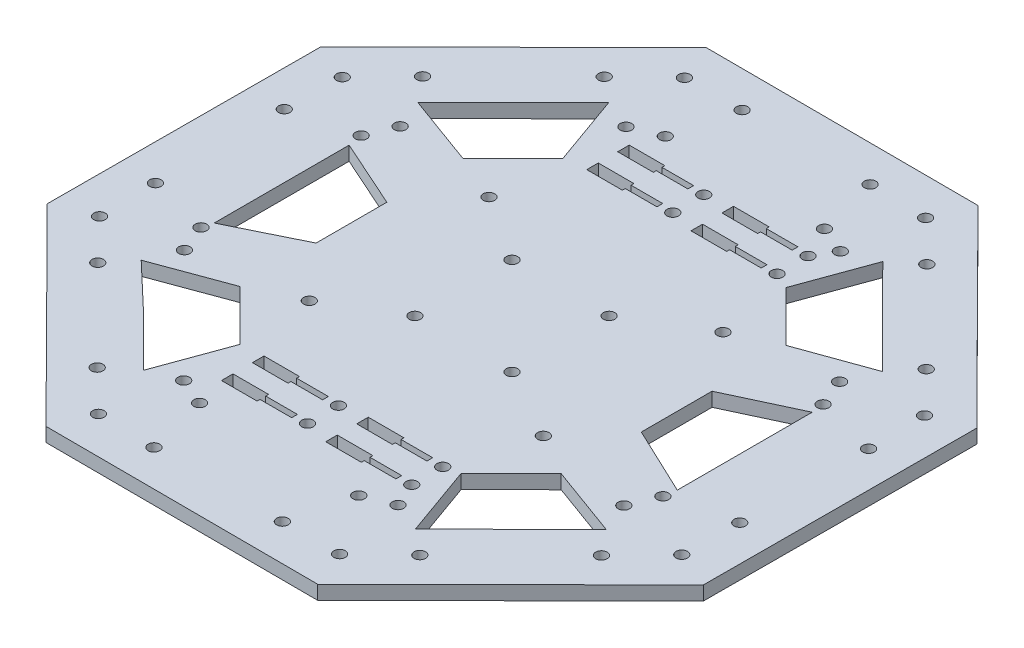
from build123d import *

# Parameters (mm, degrees)
BOSS_EXTRUDE1_DEPTH              = 4.318
CUT_EXTRUDE1_DEPTH               = 12.7
F_15_0_14_DIAMETER_HOLE1_D       = 3.556
F_15_0_14_DIAMETER_HOLE3_D       = 3.556
F_15_0_14_DIAMETER_HOLE4_D       = 3.556
F_15_0_14_DIAMETER_HOLE5_D       = 3.556
SKETCH27_R                       = 1.78
CUT_EXTRUDE2_DEPTH               = 10
F_37_0_14015748_DIAMETER_HOLE1_D = 3.559999992


with BuildPart() as part:
    # Sketch1 → Boss-Extrude1 (new body)
    with BuildSketch(Plane(origin=(0, 0, 0), x_dir=(1, 0, 0), z_dir=(0, 1, 0))):
        Polygon((-101.734861683, -41.757025965), (-42.410734357, -101.464086802), (41.757025965, -101.734861683), (101.464086802, -42.410734357), (101.734861683, 41.757025965), (42.410734357, 101.464086802), (-41.757025965, 101.734861683), (-101.464086802, 42.410734357), align=None)
    extrude(amount=BOSS_EXTRUDE1_DEPTH)

    # Sketch6 → Cut-Extrude1 (cut)
    with BuildSketch(Plane(origin=(0, 4.318, 0), x_dir=(1, 0, 0), z_dir=(0, 1, 0))):
        Polygon((-71.63902199, 42.550988515), (-56.864098396, 57.231152574), (-42.089174802, 71.911316632), (-34.257082159, 49.974181796), (-42.004907946, 42.276046985), (-49.72792821, 34.553026721), align=None)
        Polygon((71.63902199, -42.550988515), (56.864098396, -57.231152574), (42.089174802, -71.911316632), (34.257082159, -49.974181796), (42.004907946, -42.276046985), (49.752733734, -34.577912173), align=None)
        Polygon((42.697293757, 71.784388897), (57.377457815, 57.009465303), (72.088409596, 42.33049548), (50.120487037, 34.402449066), (42.422352226, 42.150274854), (34.724217415, 49.898100641), align=None)
        Polygon((-42.368336547, -71.457541467), (-57.048500606, -56.682617873), (-72.149390573, -42.337977544), (-49.816415281, -34.100407159), (-42.093395016, -41.823427424), (-34.370374752, -49.546447688), align=None)
        Polygon((72.088409596, -0.231914577), (72.088409596, 20.595875803), (51.006409596, 10.757908019), (51.006409596, -0.164091981), (51.006409596, -11.086091981), (72.088409596, -21.060124197), align=None)
        Polygon((-70.80992821, 20.525505482), (-70.80992821, -21.130494518), (-49.72792821, -10.762021003), (-49.72792821, 0.159978997), (-49.72792821, 11.081978997), align=None)
    extrude(amount=-CUT_EXTRUDE1_DEPTH, mode=Mode.SUBTRACT)

    # #15 (0.14) Diameter Hole1 (through all)
    with Locations(Plane(origin=(-37.639526742, 4.318, 90.049377036), x_dir=(0, 0, 1), z_dir=(0, 1, 0))):
        with Locations((0, 0), (0.240312708, 74.698887286), (-52.409850294, 127.688903778), (-127.10873758, 127.929216486), (-180.098754072, 75.279053484), (-180.33906678, 0.580166198), (-127.688903778, -52.409850294), (-52.990016492, -52.650163002)):
            Hole(F_15_0_14_DIAMETER_HOLE1_D / 2)

    # #15 (0.14) Diameter Hole3 (through all)
    with Locations(Plane(origin=(-71.678736662, 4.318, 24.359360544), x_dir=(0, 0, 1), z_dir=(0, 1, 0))):
        with Locations((0, 0), (8.62043802, 3.513514687), (43.592255007, 38.261038593), (47.160777382, 46.73920992), (47.319376118, 96.038097206), (43.805861431, 104.658535226), (9.058337525, 139.630352213), (0.580166198, 143.198874588), (-48.718721088, 143.357473324), (-57.339159108, 139.843958637), (-92.310976095, 105.096434731), (-95.87949847, 96.618263404), (-96.038097206, 47.319376118), (-92.524582519, 38.698938098), (-57.777058613, 3.727121111), (-49.298887286, 0.158598736)):
            Hole(F_15_0_14_DIAMETER_HOLE3_D / 2)

    # #15 (0.14) Diameter Hole4 (through all)
    with Locations(Plane(origin=(-14.986, 4.318, -14.986), x_dir=(0, 0, 1), z_dir=(0, 1, 0))):
        with Locations((0, 0), (0, 29.972), (29.972, 29.972), (29.972, 0)):
            Hole(F_15_0_14_DIAMETER_HOLE4_D / 2)

    # #15 (0.14) Diameter Hole5 (through all)
    with Locations(Plane(origin=(-35.335317857, 4.318, -28.22473094), x_dir=(0, 0, 1), z_dir=(0, 1, 0))):
        with Locations((0, 0), (55.471221795, 0), (55.471221795, 72.247883996), (0, 72.247883996)):
            Hole(F_15_0_14_DIAMETER_HOLE5_D / 2)

    # Sketch27 → Cut-Extrude2 (cut)
    with BuildSketch(Plane(origin=(0, 4.318, 0), x_dir=(1, 0, 0), z_dir=(0, 1, 0))):
        with Locations((29.664168887, -51.050357645)):
            Circle(SKETCH27_R)
        with Locations((29.659270788, -60.610357645)):
            Circle(SKETCH27_R)
        with Locations((-2.801785049, -50.779582764)):
            Circle(SKETCH27_R)
        with Locations((-2.801785049, -60.339582764)):
            Circle(SKETCH27_R)
        with Locations((-2.801785049, 52.436105192)):
            Circle(SKETCH27_R)
        with Locations((-2.801785049, 61.996105192)):
            Circle(SKETCH27_R)
        with Locations((29.664168887, 61.725728354)):
            Circle(SKETCH27_R)
        with Locations((29.659270788, 52.165728354)):
            Circle(SKETCH27_R)
        Polygon((-27.580374752, -52.55918472), (-16.580374752, -52.55918472), (-16.580374752, -51.669582764), (-6.801785049, -51.669582764), (-6.801785049, -49.88918472), (-16.580374752, -49.88918472), (-16.580374752, -48.99918472), (-27.580374752, -48.99918472), align=None)
        Polygon((-27.580374752, -62.11918472), (-16.580374752, -62.11918472), (-16.580374752, -61.229582764), (-6.801785049, -61.229582764), (-6.801785049, -59.44918472), (-16.580374752, -59.44918472), (-16.580374752, -58.55918472), (-27.580374752, -58.55918472), align=None)
        Polygon((4.885579183, -52.829959602), (15.885579183, -52.829959602), (15.885579183, -51.940357645), (25.664168887, -51.940357645), (25.664168887, -50.159959602), (15.885579183, -50.159959602), (15.885579183, -49.269959602), (4.885579183, -49.269959602), align=None)
        Polygon((4.880681084, -62.389959602), (15.880681084, -62.389959602), (15.880681084, -61.500357645), (25.659270788, -61.500357645), (25.659270788, -59.719959602), (15.880681084, -59.719959602), (15.880681084, -58.829959602), (4.880681084, -58.829959602), align=None)
        Polygon((-27.580374752, 60.216503235), (-16.580374752, 60.216503235), (-16.580374752, 61.106105192), (-6.801785049, 61.106105192), (-6.801785049, 62.886503235), (-16.580374752, 62.886503235), (-16.580374752, 63.776503235), (-27.580374752, 63.776503235), align=None)
        Polygon((-27.580374752, 50.656503235), (-16.580374752, 50.656503235), (-16.580374752, 51.546105192), (-6.801785049, 51.546105192), (-6.801785049, 53.326503235), (-16.580374752, 53.326503235), (-16.580374752, 54.216503235), (-27.580374752, 54.216503235), align=None)
        Polygon((4.885579183, 59.945728354), (15.885579183, 59.945728354), (15.885579183, 60.83533031), (25.664168887, 60.83533031), (25.664168887, 62.615728354), (15.885579183, 62.615728354), (15.885579183, 63.505728354), (4.885579183, 63.505728354), align=None)
        Polygon((4.880681084, 50.385728354), (15.880681084, 50.385728354), (15.880681084, 51.27533031), (25.659270788, 51.27533031), (25.659270788, 53.055728354), (15.880681084, 53.055728354), (15.880681084, 53.945728354), (4.880681084, 53.945728354), align=None)
    extrude(amount=-CUT_EXTRUDE2_DEPTH, mode=Mode.SUBTRACT)

    # #37 (0.14015748) Diameter Hole1 (through all)
    with Locations(Plane(origin=(-20.114804764, 4.318, 90.434483218), x_dir=(0, 0, 1), z_dir=(0, 1, 0))):
        with Locations((0, 0), (0, 39.65), (-12.257100049, 69.832855187), (-40.203542574, 97.959690241), (-70.314956476, 110.550546846), (-109.964751296, 110.678103626), (-140.152533641, 98.292187933), (-168.279368695, 70.345745408), (-180.870211594, 40.238591937), (-180.997768374, 0.588797117), (-168.611866387, -29.603245659), (-140.665423862, -57.730080713), (-110.55400996, -70.320937318), (-70.90421514, -70.448494098), (-40.716432795, -58.062578405), (-12.589597741, -30.11613588)):
            Hole(F_37_0_14015748_DIAMETER_HOLE1_D / 2)


solid = part.part
